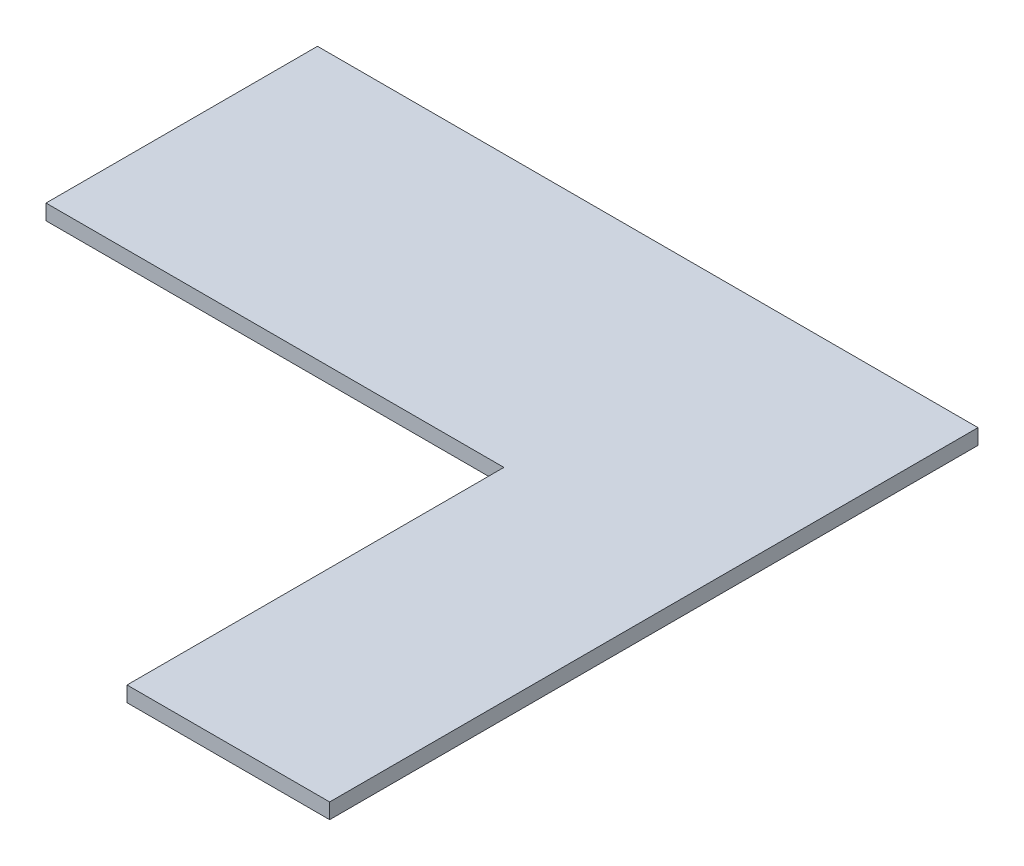
from build123d import *

# Parameters (mm, degrees)
EXTRUDE_1_DEPTH = 38


with BuildPart() as part:
    # Эскиз1 → Бобышка-Вытянуть1 (new body)
    with BuildSketch(Plane(origin=(0, 0, 0), x_dir=(1, 0, 0), z_dir=(0, 1, 0))):
        Polygon((0, 0), (0, 670), (1630, 670), (1630, -930), (1130, -930), (1130, 0), align=None)
    extrude(amount=EXTRUDE_1_DEPTH)


solid = part.part
